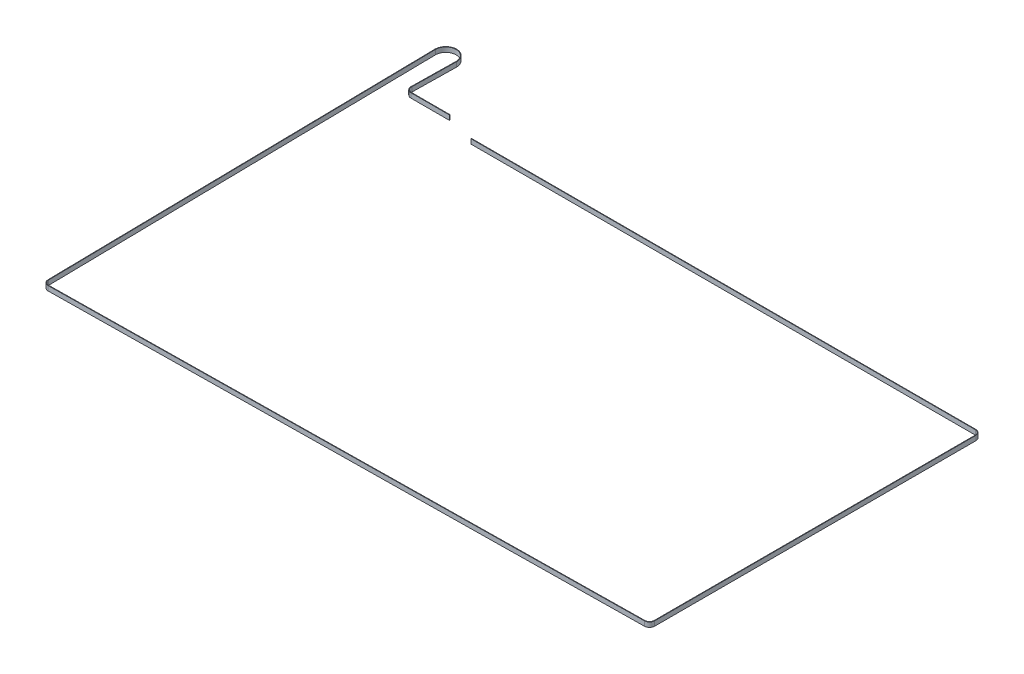
from build123d import *

# Parameters (mm, degrees)
SKETCH5_W = 0.67
SKETCH5_H = 6


with BuildPart() as part:
    # Sweep3: sweep along a path in Sketch2
    with BuildLine(Plane(origin=(0, 12.5, 0), x_dir=(-1, 0, 0), z_dir=(0, -1, 0))) as sweep3_path:
        Line((-67.938579371, -63.088579371), (-19, -63.088579371))
        ThreePointArc((-19, -63.088579371), (-14.310312548, -61.045612122), (-12.612715406, -56.220153852))
        Line((-12.612715406, -56.220153852), (-13.498312613, -0.213439909))
        ThreePointArc((-13.498312613, -0.213439909), (-0.10672329, 13.499578147), (13.5, 0))
        Line((13.5, 0), (5.575, -501.15))
        ThreePointArc((5.575, -501.15), (3.744417382, -505.569417382), (-0.675, -507.4))
        Line((-0.675, -507.4), (-751, -497.4))
        ThreePointArc((-751, -497.4), (-755.419417382, -495.569417382), (-757.25, -491.15))
        Line((-757.25, -491.15), (-757.25, -81.588579371))
        ThreePointArc((-757.25, -81.588579371), (-755.419417382, -77.169161988), (-751, -75.338579371))
        Line((-751, -75.338579371), (-107.938579371, -75.588579371))
    # Sketch5 → Sweep3 (sweep)
    with BuildSketch(Plane(origin=(-13.5, 12.5, 0), x_dir=(0.9998749880202957, 0, -0.015811651761071195), z_dir=(0.015811651761071195, 0, 0.9998749880202957))):
        Rectangle(SKETCH5_W, SKETCH5_H)
    sweep(path=sweep3_path.line, transition=Transition.RIGHT)


solid = part.part
